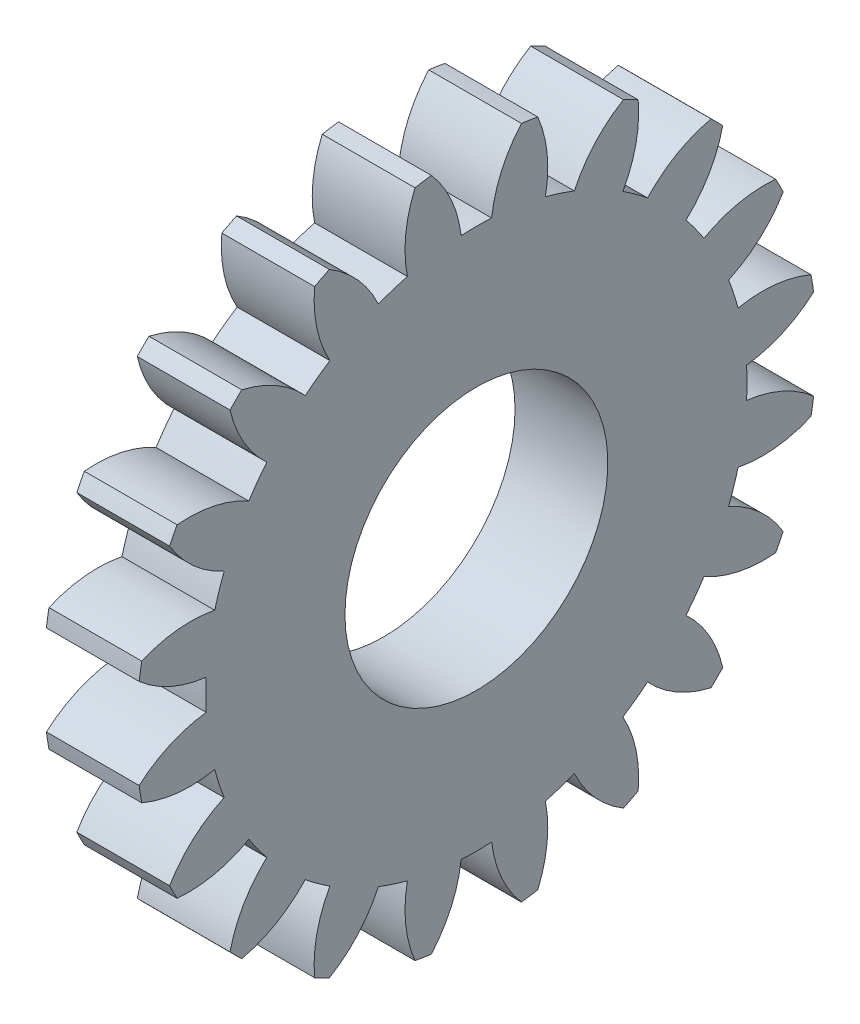
from build123d import *

# Parameters (mm, degrees)
BASPROSKE_W     = 6
BASPROSKE_H     = 22
TOOTHCUT_DEPTH  = 32.685959036
TEETHCUTS_COUNT = 20
TEETHCUTS_ANGLE = 342
BORSKE_R        = 8.5
BORE_DEPTH      = 50.0000508


with BuildPart() as part:
    # BasProSke → Base-Revolve (revolve)
    with BuildSketch(Plane(origin=(0, 0, 0), x_dir=(1, 0, 0), z_dir=(0, 1, 0))):
        with Locations((3, 11)):
            Rectangle(BASPROSKE_W, BASPROSKE_H)
    revolve(axis=Axis((-10, 0, 0), (1, 0, 0)))

    # TooCutSke → ToothCut (cut, through all)
    with BuildSketch(Plane(origin=(0, 0, 0), x_dir=(0, 0, -1), z_dir=(1, 0, 0))):
        with BuildLine():
            ThreePointArc((0.986171591, 17.471189616), (0, 17.499), (-0.986171591, 17.471189616))
            ThreePointArc((-0.986171591, 17.471189616), (-1.626916196, 19.798789858), (-2.932850173, 21.829260982))
            ThreePointArc((-2.932850173, 21.829260982), (0, 22.0254), (2.932850173, 21.829260982))
            ThreePointArc((2.932850173, 21.829260982), (1.626916196, 19.798789858), (0.986171591, 17.471189616))
        make_face()
    toothcut = extrude(amount=TOOTHCUT_DEPTH, mode=Mode.SUBTRACT)

    # TeethCuts: ToothCut ×20 about axis
    teethcuts_axis = Axis((-10, 0, 0), (1, 0, 0))
    for i in range(1, TEETHCUTS_COUNT):
        add(toothcut.rotate(teethcuts_axis, i * TEETHCUTS_ANGLE / (TEETHCUTS_COUNT - 1)), mode=Mode.SUBTRACT)

    # BorSke → Bore (cut, symmetric)
    with BuildSketch(Plane(origin=(0, 0, 0), x_dir=(0, 0, -1), z_dir=(1, 0, 0))):
        Circle(BORSKE_R)
    extrude(amount=BORE_DEPTH, both=True, mode=Mode.SUBTRACT)


solid = part.part
